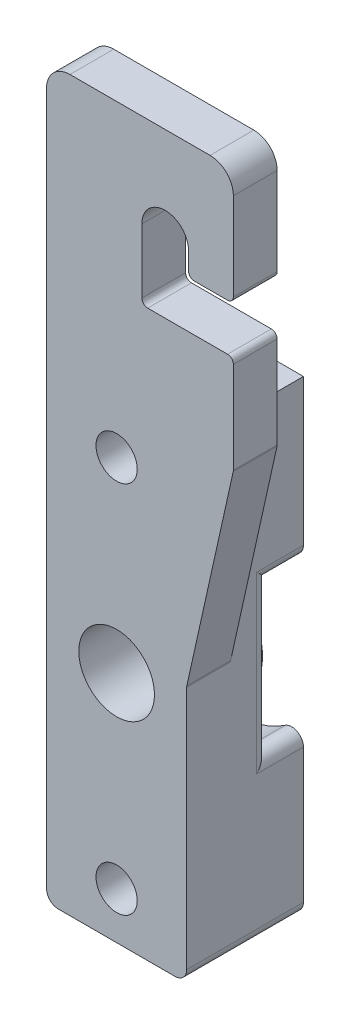
from build123d import *

# Parameters (mm, degrees)
SKETCH1_W                  = 19.05
SKETCH1_H                  = 63.5
BOSS_EXTRUDE1_DEPTH        = 15.875
SKETCH2_R                  = 5.1435
CUT_EXTRUDE1_DEPTH         = 37.753282166
SKETCH3_R                  = 12.7
CUT_EXTRUDE2_DEPTH         = 3.96875
SKETCH4_R                  = 12.7
SKETCH4_R_2                = 7.9375
CUT_EXTRUDE3_DEPTH         = 0.79375
F_10_CLEARANCE_HOLE1_D     = 5.6134
F_10_CLEARANCE_HOLE1_DEPTH = 25.4
F_10_CLEARANCE_HOLE1_TIP   = 1.686435499
FILLET1_R                  = 1.5875
BOSS_EXTRUDE2_DEPTH        = 5.953125
FILLET3_R                  = 0.79375
FILLET4_R                  = 3.175


with BuildPart() as part:
    # Sketch1 → Boss-Extrude1 (new body)
    with BuildSketch(Plane.XY):
        Rectangle(SKETCH1_W, SKETCH1_H)
    extrude(amount=BOSS_EXTRUDE1_DEPTH)

    # Sketch2 → Cut-Extrude1 (cut, through all)
    with BuildSketch(Plane.XY.offset(15.875)):
        Circle(SKETCH2_R)
    extrude(amount=-CUT_EXTRUDE1_DEPTH, mode=Mode.SUBTRACT)

    # Sketch3 → Cut-Extrude2 (cut)
    with BuildSketch(Plane.XY.offset(15.875)):
        Circle(SKETCH3_R)
    extrude(amount=-CUT_EXTRUDE2_DEPTH, mode=Mode.SUBTRACT)

    # Sketch4 → Cut-Extrude3 (cut)
    with BuildSketch(Plane.XY.offset(11.90625)):
        Circle(SKETCH4_R)
        Circle(SKETCH4_R_2, mode=Mode.SUBTRACT)
    extrude(amount=-CUT_EXTRUDE3_DEPTH, mode=Mode.SUBTRACT)

    # #10 Clearance Hole1
    with Locations(Plane.XY.offset(15.875)):
        with Locations((0, 25.4), (0, -25.4)):
            Hole(F_10_CLEARANCE_HOLE1_D / 2, depth=F_10_CLEARANCE_HOLE1_DEPTH)
            with Locations((0, 0, -(F_10_CLEARANCE_HOLE1_DEPTH + F_10_CLEARANCE_HOLE1_TIP / 2))):  # 118° drill point
                Cone(0, F_10_CLEARANCE_HOLE1_D / 2, F_10_CLEARANCE_HOLE1_TIP, mode=Mode.SUBTRACT)

    # Fillet1
    fillet1_edges = [part.edges().sort_by_distance(p)[0] for p in [
        (9.525, -8.400260413, 13.49375),
        (-9.525, -8.400260413, 13.49375),
        (9.525, 8.400260413, 13.49375),
        (-9.525, 8.400260413, 13.49375),
        (-9.525, 0, 11.1125),
        (9.525, 0, 11.1125),
        (9.525, -31.75, 7.9375),
        (-9.525, -31.75, 7.9375),
    ]]
    fillet(fillet1_edges, radius=FILLET1_R - 0.0001)  # a hair under: the kernel refuses the full size

    # Sketch12 → Boss-Extrude2 (add)
    with BuildSketch(Plane(origin=(0, 0, 0), x_dir=(-1, 0, 0), z_dir=(0, 0, -1))):
        with BuildLine():
            Line((-15.875, 67.31), (-15.875, 51.435))
            Line((-15.875, 51.435), (-9.779, 51.435))
            Line((-9.779, 51.435), (-9.779, 54.61))
            ThreePointArc((-9.779, 54.61), (-6.604, 57.785), (-3.429, 54.61))
            Line((-3.429, 54.61), (-3.429, 45.085))
            Line((-3.429, 45.085), (-15.875, 45.085))
            Line((-15.875, 45.085), (-15.875, 31.75))
            Line((-15.875, 31.75), (-9.525, 3.175))
            Line((-9.525, 3.175), (-9.525, 31.75))
            Line((-9.525, 31.75), (9.525, 31.75))
            Line((9.525, 31.75), (9.525, 67.31))
            Line((9.525, 67.31), (-15.875, 67.31))
        make_face()
    extrude(amount=-BOSS_EXTRUDE2_DEPTH)

    # Fillet3
    fillet3_edges = [part.edges().sort_by_distance(p)[0] for p in [
        (9.779, 51.435, 2.9765625),
        (15.875, 51.435, 2.9765625),
        (9.525, 3.175, 2.9765625),
        (15.875, 31.75, 2.9765625),
        (15.875, 45.085, 2.9765625),
        (3.429, 45.085, 2.9765625),
    ]]
    fillet(fillet3_edges, radius=FILLET3_R)

    # Fillet4
    fillet4_edges = [part.edges().sort_by_distance(p)[0] for p in [
        (15.875, 67.31, 2.9765625),
        (-9.525, 67.31, 2.9765625),
    ]]
    fillet(fillet4_edges, radius=FILLET4_R)


with BuildPart() as body_2:
    # Mirror1: mirrored copy
    add(part.part.mirror(Plane.XY.offset(15.875)))


solid = body_2.part
